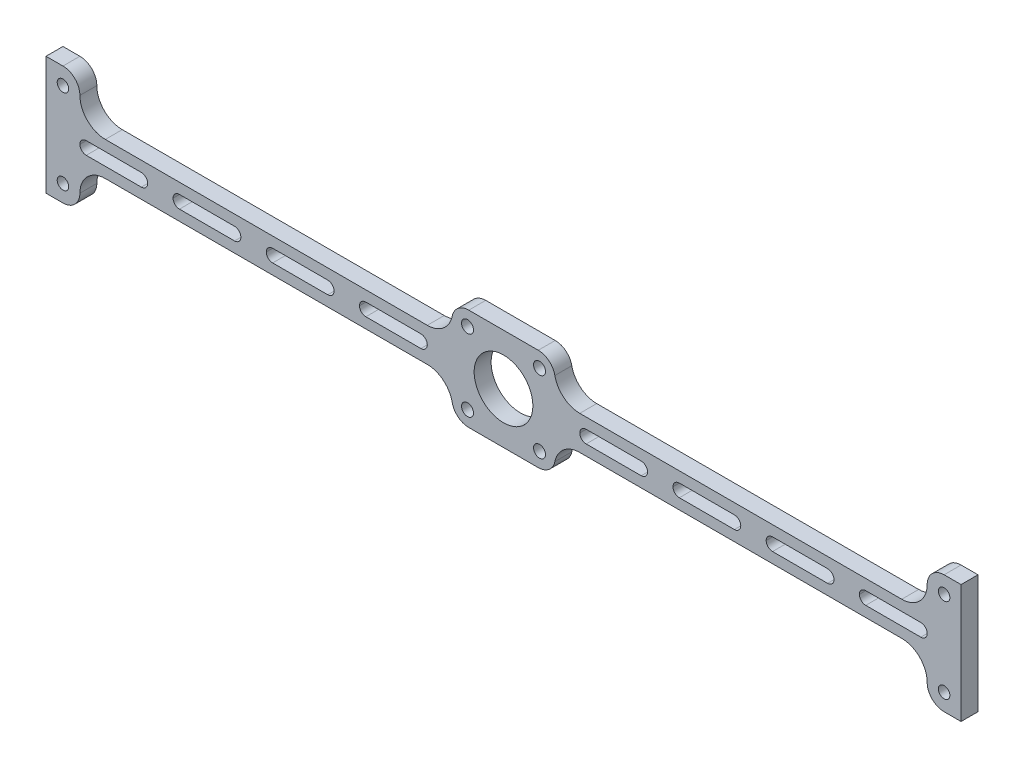
from build123d import *

# Parameters (mm, degrees)
SKETCH4_W            = 139.7
SKETCH4_H            = 12.7
SKETCH4_W_2          = 38.1
BOSS_EXTRUDE2_DEPTH  = 6.35
FILLET4_R            = 9.525
FILLET5_R            = 6.35
SKETCH5_R            = 11
SKETCH5_R_2          = 2.15265
CUT_EXTRUDE1_DEPTH   = 6.35
SKETCH6_R            = 2.2479
CUT_EXTRUDE2_DEPTH   = 6.35
CUT_EXTRUDE3_DEPTH   = 6.35
LPATTERN1_COUNT      = 4
LPATTERN1_PITCH      = 34.925
MIRROR1_COPY_1_DEPTH = 6.35
MIRROR1_COPY_2_DEPTH = 6.35
MIRROR1_COPY_3_DEPTH = 6.35


with BuildPart() as part:
    # Sketch4 → Boss-Extrude2 (new body)
    with BuildSketch(Plane.XY):
        Polygon((-158.75, -22.225), (-158.75, -6.35), (-158.75, 6.35), (-158.75, 22.225), (-171.45, 22.225), (-171.45, -22.225), align=None)
        with Locations((-88.9, 0)):
            Rectangle(SKETCH4_W, SKETCH4_H)
        with Locations((0, 12.7)):
            Rectangle(SKETCH4_W_2, SKETCH4_H)
        Rectangle(SKETCH4_W_2, SKETCH4_H)
        with Locations((0, -12.7)):
            Rectangle(SKETCH4_W_2, SKETCH4_H)
        with Locations((88.9, 0)):
            Rectangle(SKETCH4_W, SKETCH4_H)
        Polygon((158.75, 6.35), (158.75, -6.35), (158.75, -22.225), (171.45, -22.225), (171.45, 22.225), (158.75, 22.225), align=None)
    extrude(amount=BOSS_EXTRUDE2_DEPTH)

    # Fillet4
    fillet4_edges = [part.edges().sort_by_distance(p)[0] for p in [
        (-158.75, 6.35, 3.175),
        (-19.05, 6.35, 3.175),
        (19.05, 6.35, 3.175),
        (158.75, 6.35, 3.175),
        (158.75, -6.35, 3.175),
        (19.05, -6.35, 3.175),
        (-19.05, -6.35, 3.175),
        (-158.75, -6.35, 3.175),
    ]]
    fillet(fillet4_edges, radius=FILLET4_R)

    # Fillet5
    fillet5_edges = [part.edges().sort_by_distance(p)[0] for p in [
        (-158.75, 22.225, 3.175),
        (-158.75, -22.225, 3.175),
        (158.75, -22.225, 3.175),
        (158.75, 22.225, 3.175),
        (19.05, 19.05, 3.175),
        (-19.05, 19.05, 3.175),
        (-19.05, -19.05, 3.175),
        (19.05, -19.05, 3.175),
    ]]
    fillet(fillet5_edges, radius=FILLET5_R - 0.0001)  # a hair under: the kernel refuses the full size

    # Sketch5 → Cut-Extrude1 (cut)
    with BuildSketch(Plane.XY.offset(6.35)):
        Circle(SKETCH5_R)
        with Locations((-165.1, 15.875)):
            Circle(SKETCH5_R_2)
        with Locations((-165.1, -15.875)):
            Circle(SKETCH5_R_2)
        with Locations((165.1, 15.875)):
            Circle(SKETCH5_R_2)
        with Locations((165.1, -15.875)):
            Circle(SKETCH5_R_2)
    extrude(amount=-CUT_EXTRUDE1_DEPTH, mode=Mode.SUBTRACT)

    # Sketch6 → Cut-Extrude2 (cut)
    with BuildSketch(Plane.XY.offset(6.35)):
        with Locations((-13.49375, -13.49375)):
            Circle(SKETCH6_R)
        with Locations((13.49375, -13.49375)):
            Circle(SKETCH6_R)
        with Locations((13.49375, 13.49375)):
            Circle(SKETCH6_R)
        with Locations((-13.49375, 13.49375)):
            Circle(SKETCH6_R)
    extrude(amount=-CUT_EXTRUDE2_DEPTH, mode=Mode.SUBTRACT)

    # Sketch7 → Cut-Extrude3 (cut)
    with BuildSketch(Plane.XY.offset(6.35)):
        with BuildLine():
            Line((-156.369004, 2.38125), (-135.730996005, 2.38125))
            ThreePointArc((-135.730996005, 2.38125), (-134.047377588, 1.683872418), (-133.350000005, 0.000254))
            ThreePointArc((-133.350000005, 0.000254), (-134.047377588, -1.683872418), (-135.730996005, -2.38125))
            Line((-135.730996005, -2.38125), (-156.369004, -2.38125))
            ThreePointArc((-156.369004, -2.38125), (-158.052622418, -1.683872418), (-158.75, 0.000254))
            ThreePointArc((-158.75, 0.000254), (-158.052622418, 1.683872418), (-156.369004, 2.38125))
        make_face()
    cut_extrude3 = extrude(amount=-CUT_EXTRUDE3_DEPTH, mode=Mode.SUBTRACT)

    # LPattern1: Cut-Extrude3 ×4
    with Locations(*[(i * LPATTERN1_PITCH, 0, 0) for i in range(1, LPATTERN1_COUNT)]):
        add(cut_extrude3, mode=Mode.SUBTRACT)

    # Mirror1: Cut-Extrude3 across plane
    add(cut_extrude3.mirror(Plane(origin=(0, 0, 0), x_dir=(0, 0, 1), z_dir=(1, 0, 0))), mode=Mode.SUBTRACT)

    # Mirror1 copy 1 sketch → Mirror1 copy 1 (cut)
    with BuildSketch(Plane(origin=(-34.925, 0, 6.35), x_dir=(-1, 0, 0), z_dir=(0, 0, 1))):
        with BuildLine():
            Line((-156.369004, -2.38125), (-135.730996005, -2.38125))
            ThreePointArc((-135.730996005, -2.38125), (-134.047377588, -1.683872418), (-133.350000005, -0.000254))
            ThreePointArc((-133.350000005, -0.000254), (-134.047377588, 1.683872418), (-135.730996005, 2.38125))
            Line((-135.730996005, 2.38125), (-156.369004, 2.38125))
            ThreePointArc((-156.369004, 2.38125), (-158.052622418, 1.683872418), (-158.75, -0.000254))
            ThreePointArc((-158.75, -0.000254), (-158.052622418, -1.683872418), (-156.369004, -2.38125))
        make_face()
    extrude(amount=-MIRROR1_COPY_1_DEPTH, mode=Mode.SUBTRACT)

    # Mirror1 copy 2 sketch → Mirror1 copy 2 (cut)
    with BuildSketch(Plane(origin=(-69.85, 0, 6.35), x_dir=(-1, 0, 0), z_dir=(0, 0, 1))):
        with BuildLine():
            Line((-156.369004, -2.38125), (-135.730996005, -2.38125))
            ThreePointArc((-135.730996005, -2.38125), (-134.047377588, -1.683872418), (-133.350000005, -0.000254))
            ThreePointArc((-133.350000005, -0.000254), (-134.047377588, 1.683872418), (-135.730996005, 2.38125))
            Line((-135.730996005, 2.38125), (-156.369004, 2.38125))
            ThreePointArc((-156.369004, 2.38125), (-158.052622418, 1.683872418), (-158.75, -0.000254))
            ThreePointArc((-158.75, -0.000254), (-158.052622418, -1.683872418), (-156.369004, -2.38125))
        make_face()
    extrude(amount=-MIRROR1_COPY_2_DEPTH, mode=Mode.SUBTRACT)

    # Mirror1 copy 3 sketch → Mirror1 copy 3 (cut)
    with BuildSketch(Plane(origin=(-104.775, 0, 6.35), x_dir=(-1, 0, 0), z_dir=(0, 0, 1))):
        with BuildLine():
            Line((-156.369004, -2.38125), (-135.730996005, -2.38125))
            ThreePointArc((-135.730996005, -2.38125), (-134.047377588, -1.683872418), (-133.350000005, -0.000254))
            ThreePointArc((-133.350000005, -0.000254), (-134.047377588, 1.683872418), (-135.730996005, 2.38125))
            Line((-135.730996005, 2.38125), (-156.369004, 2.38125))
            ThreePointArc((-156.369004, 2.38125), (-158.052622418, 1.683872418), (-158.75, -0.000254))
            ThreePointArc((-158.75, -0.000254), (-158.052622418, -1.683872418), (-156.369004, -2.38125))
        make_face()
    extrude(amount=-MIRROR1_COPY_3_DEPTH, mode=Mode.SUBTRACT)


solid = part.part
